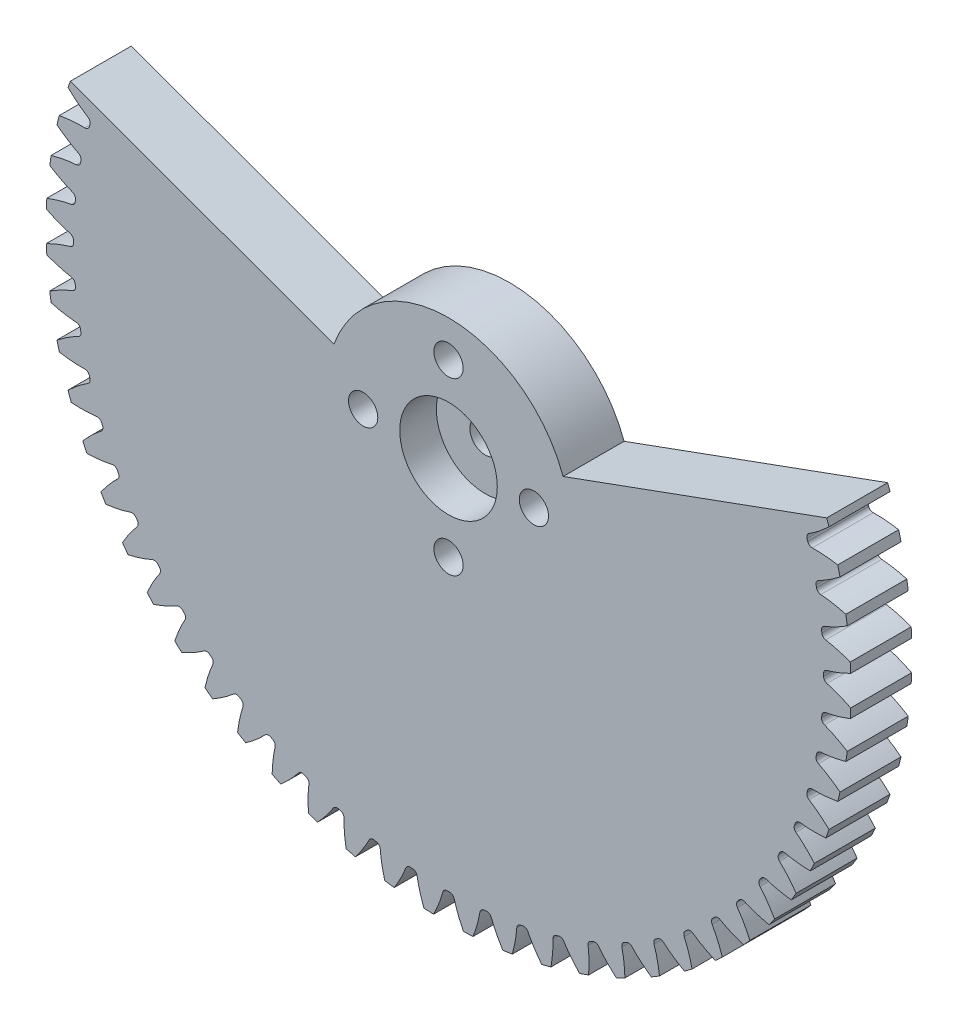
from build123d import *

# Parameters (mm, degrees)
SKETCH_1_R          = 33
LASHENA_DEPTH       = 5
CUT_EXTRUDEA_DEPTH  = 30
WWW_KYTOOL_CN_COUNT = 64
SKETCH_4_R          = 1.2
CUT_EXTRUDE_2_DEPTH = 10
SKETCH_5_R          = 4
CUT_EXTRUDE_3_DEPTH = 3
SKETCH_6_R          = 1.25
CUT_EXTRUDE_4_DEPTH = 3
CUT_EXTRUDE_5_DEPTH = 13


with BuildPart() as part:
    # 草图1 → LaShenA (new body)
    with BuildSketch(Plane.XY):
        Circle(SKETCH_1_R)
    extrude(amount=LASHENA_DEPTH)

    # SketchA → Cut-ExtrudeA (cut)
    with BuildSketch(Plane.XY.offset(5)):
        with BuildLine():
            ThreePointArc((0.096633673, 30.749848161), (0, 30.75), (-0.096633673, 30.749848161))
            ThreePointArc((-0.096633673, 30.749848161), (-0.327612081, 30.827192679), (-0.464173357, 31.028895969))
            add(Edge.make_bspline(
                [(-0.464173357, 31.028895969), (-0.468782612, 31.045622808), (-0.479164073, 31.083136697), (-0.495762432, 31.141999797), (-0.514432253, 31.206032477), (-0.534174013, 31.271805458), (-0.555034025, 31.339300249), (-0.577036702, 31.408504382), (-0.600212389, 31.479403244), (-0.624589572, 31.551982363), (-0.650197056, 31.626226774), (-0.677063345, 31.702121193), (-0.705216814, 31.779649974), (-0.734685656, 31.858797125), (-0.76549789, 31.939546301), (-0.797681358, 32.021880812), (-0.831263714, 32.10578362), (-0.866272429, 32.191237347), (-0.902734781, 32.278224271), (-0.940677856, 32.366726329), (-0.980128538, 32.456725124), (-1.021113513, 32.548201919), (-1.063659259, 32.641137647), (-1.107792046, 32.735512906), (-1.15353793, 32.831307968), (-1.200922753, 32.928502776), (-1.249972133, 33.027076948), (-1.300711469, 33.12700978), (-1.353165926, 33.228280245), (-1.426039675, 33.366225561), (-1.482431184, 33.46987635), (-1.520892178, 33.53924812)],
                knots=[0.096686069, 0.096686069, 0.096686069, 0.096686069, 0.113907769, 0.135323729, 0.157392471, 0.180113994, 0.203488299, 0.227515386, 0.252195255, 0.277527905, 0.303513337, 0.330151551, 0.357442547, 0.385386324, 0.413982884, 0.443232225, 0.473134347, 0.503689252, 0.534896938, 0.566757406, 0.599270656, 0.632436687, 0.666255501, 0.700727096, 0.735851473, 0.771628631, 0.808058572, 0.845141294, 0.882876798, 0.921265083, 1, 1, 1, 1], degree=3))
            ThreePointArc((-1.520892178, 33.53924812), (0, 33.573714085), (1.520892178, 33.53924812))
            add(Edge.make_bspline(
                [(0.464173357, 31.028895969), (0.468782612, 31.045622808), (0.479164073, 31.083136697), (0.495762432, 31.141999797), (0.514432253, 31.206032477), (0.534174013, 31.271805458), (0.555034025, 31.339300249), (0.577036702, 31.408504382), (0.600212389, 31.479403244), (0.624589572, 31.551982363), (0.650197056, 31.626226774), (0.677063345, 31.702121193), (0.705216814, 31.779649974), (0.734685656, 31.858797125), (0.76549789, 31.939546301), (0.797681358, 32.021880812), (0.831263714, 32.10578362), (0.866272429, 32.191237347), (0.902734781, 32.278224271), (0.940677856, 32.366726329), (0.980128538, 32.456725124), (1.021113513, 32.548201919), (1.063659259, 32.641137647), (1.107792046, 32.735512906), (1.15353793, 32.831307968), (1.200922753, 32.928502776), (1.249972133, 33.027076948), (1.300711469, 33.12700978), (1.353165926, 33.228280245), (1.426039675, 33.366225561), (1.482431184, 33.46987635), (1.520892178, 33.53924812)],
                knots=[0.096686069, 0.096686069, 0.096686069, 0.096686069, 0.113907769, 0.135323729, 0.157392471, 0.180113994, 0.203488299, 0.227515386, 0.252195255, 0.277527905, 0.303513337, 0.330151551, 0.357442547, 0.385386324, 0.413982884, 0.443232225, 0.473134347, 0.503689252, 0.534896938, 0.566757406, 0.599270656, 0.632436687, 0.666255501, 0.700727096, 0.735851473, 0.771628631, 0.808058572, 0.845141294, 0.882876798, 0.921265083, 1, 1, 1, 1], degree=3))
            ThreePointArc((0.464173357, 31.028895969), (0.327612081, 30.827192679), (0.096633673, 30.749848161))
        make_face()
    cut_extrudea = extrude(amount=-CUT_EXTRUDEA_DEPTH, mode=Mode.SUBTRACT)

    # www.KYTool.cn: Cut-ExtrudeA ×64 about axis
    www_kytool_cn_axis = Axis((0, 0, -88.99), (0, 0, 1))
    for i in range(1, WWW_KYTOOL_CN_COUNT):
        add(cut_extrudea.rotate(www_kytool_cn_axis, i * 360 / WWW_KYTOOL_CN_COUNT), mode=Mode.SUBTRACT)

    # 草图4 → 切除-拉伸2 (cut)
    with BuildSketch(Plane.XY.offset(5)):
        with Locations((7, 0)):
            Circle(SKETCH_4_R)
        with Locations((0, -7)):
            Circle(SKETCH_4_R)
        with Locations((-7, 0)):
            Circle(SKETCH_4_R)
        with Locations((0, 7)):
            Circle(SKETCH_4_R)
    extrude(amount=-CUT_EXTRUDE_2_DEPTH, mode=Mode.SUBTRACT)

    # 草图5 → 切除-拉伸3 (cut)
    with BuildSketch(Plane.XY.offset(5)):
        Circle(SKETCH_5_R)
    extrude(amount=-CUT_EXTRUDE_3_DEPTH, mode=Mode.SUBTRACT)

    # 草图6 → 切除-拉伸4 (cut)
    with BuildSketch(Plane.XY.offset(2)):
        Circle(SKETCH_6_R)
    extrude(amount=-CUT_EXTRUDE_4_DEPTH, mode=Mode.SUBTRACT)

    # 草图7 → 切除-拉伸5 (cut)
    with BuildSketch(Plane.XY.offset(5)):
        with BuildLine():
            Line((9.396926208, 3.420201433), (40.237183504, 14.645137106))
            Line((40.237183504, 14.645137106), (-1.09112017, 49.282261027))
            Line((-1.09112017, 49.282261027), (-39.930839686, 14.533637075))
            Line((-39.930839686, 14.533637075), (-9.396926208, 3.420201433))
            ThreePointArc((-9.396926208, 3.420201433), (0, 10), (9.396926208, 3.420201433))
        make_face()
    extrude(amount=-CUT_EXTRUDE_5_DEPTH, mode=Mode.SUBTRACT)


solid = part.part
